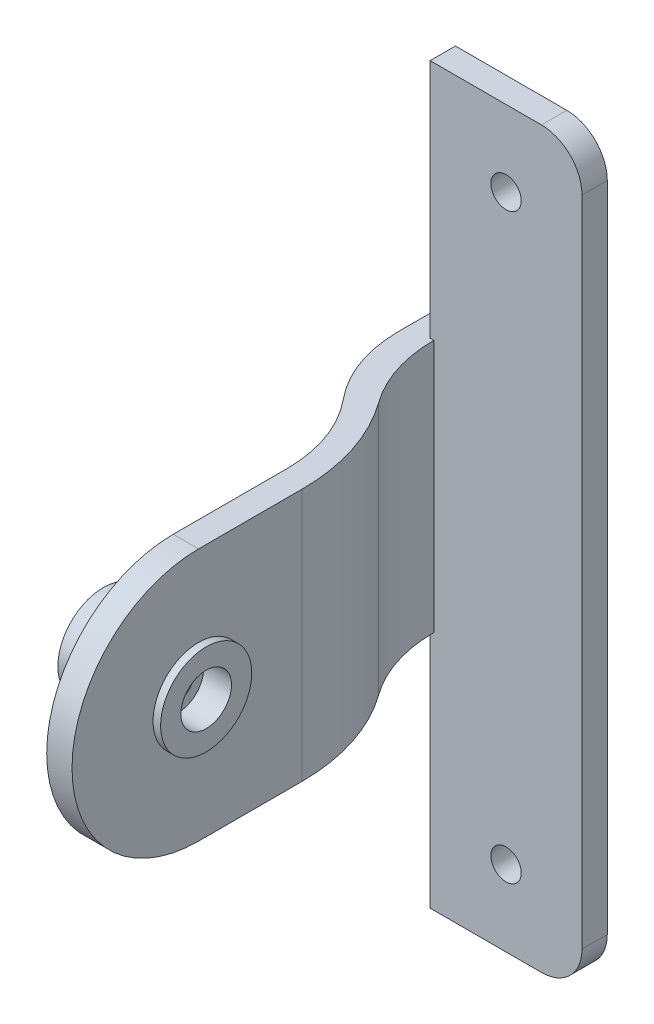
from build123d import *
from build123d.topology import SkipClean

# Parameters (mm, degrees)
SKETCH1_R                = 1.5
BOSS_EXTRUDE1_DEPTH      = 2.5
BOSS_EXTRUDE2_DEPTH      = 6.9
BOSS_EXTRUDE2_DEPTH_BACK = 2.5
SKETCH2_R                = 4.5
SKETCH2_R_2              = 1.5
SKETCH4_R                = 2.5
CUT_EXTRUDE1_DEPTH       = 2
BOSS_EXTRUDE3_START      = 0.75
SKETCH5_R                = 4.5
SKETCH5_R_2              = 2.5
BOSS_EXTRUDE3_DEPTH      = 0.75
BOSS_EXTRUDE4_DEPTH      = 2.5
CUT_EXTRUDE2_REACH       = 80.314
SKETCH7_W                = 7
SKETCH7_H                = 16.5
SKETCH7_W_2              = 16
SKETCH7_H_2              = 8
CUT_EXTRUDE3_REACH       = 82.041
SKETCH9_W                = 2.5
SKETCH9_H                = 22.388822383
BOSS_EXTRUDE5_DEPTH      = 12.5
FILLET2_R                = 1
FILLET3_R                = 4
CUT_EXTRUDE4_DEPTH       = 74.103052287
CUT_EXTRUDE4_DEPTH_BACK  = 74.103052287
SKETCH10_W               = 78.235731334
SKETCH10_H               = 6.290045588
SKETCH11_W               = 14.64
SKETCH11_H               = 2.5
BOSS_EXTRUDE6_DEPTH      = 12.5
BOSS_EXTRUDE7_DEPTH      = 2.5
SKETCH14_R               = 1.5
CUT_EXTRUDE5_DEPTH       = 2.5


with BuildPart() as part:
    # Sketch1 → Boss-Extrude1 (new body)
    with BuildSketch(Plane(origin=(0, 0, 0), x_dir=(0, 0, -1), z_dir=(1, 0, 0))):
        with BuildLine():
            Line((0, 12.5), (34.45, 12.5))
            Line((34.45, 12.5), (34.45, -12.5))
            Line((34.45, -12.5), (0, -12.5))
            ThreePointArc((0, -12.5), (-12.5, 0), (0, 12.5))
        make_face()
        Circle(SKETCH1_R, mode=Mode.SUBTRACT)
    extrude(amount=BOSS_EXTRUDE1_DEPTH)

    # Sketch2 → Boss-Extrude2 (add, two sides: drawn at the far end of the back side and taken through both)
    with BuildSketch(Plane.ZY.offset(-BOSS_EXTRUDE2_DEPTH_BACK)):
        Circle(SKETCH2_R)
        Circle(SKETCH2_R_2, mode=Mode.SUBTRACT)
    extrude(amount=BOSS_EXTRUDE2_DEPTH + BOSS_EXTRUDE2_DEPTH_BACK)

    # Sketch4 → Cut-Extrude1 (cut)
    with BuildSketch(Plane(origin=(2.5, 0, 0), x_dir=(0, 0, -1), z_dir=(1, 0, 0))):
        Circle(SKETCH4_R)
    extrude(amount=-CUT_EXTRUDE1_DEPTH, mode=Mode.SUBTRACT)

    # Sketch5 → Boss-Extrude3 (add)
    with SkipClean():  # the faces are left unmerged after this step: merging them gives an invalid solid
        with BuildSketch(Plane(origin=(2.5, 0, 0), x_dir=(0, 0, -1), z_dir=(1, 0, 0)).offset(BOSS_EXTRUDE3_START)):
            with Locations(Location((0, 0, 0), (0, 0, 180))):
                Circle(SKETCH5_R)
            Circle(SKETCH5_R_2, mode=Mode.SUBTRACT)
        extrude(amount=-BOSS_EXTRUDE3_DEPTH)

    # Sketch6 → Boss-Extrude4 (add)
    with SkipClean():  # the faces are left unmerged after this step: merging them gives an invalid solid
        with BuildSketch(Plane(origin=(0, 0, -34.45), x_dir=(-1, 0, 0), z_dir=(0, 0, -1))):
            Polygon((-8.812505246, 36.25), (53.321583376, 36.25), (53.321583376, -36.25), (6.25, -36.25), (-19.178416624, -36.25), (-19.178416624, 36.25), align=None)
        extrude(amount=-BOSS_EXTRUDE4_DEPTH)
    add(part.part.scale(1), mode=Mode.REPLACE)  # the faces are merged on a copy

    # Sketch7 → Cut-Extrude2 (cut, up to next)
    with BuildSketch(Plane.XY.offset(-31.95), mode=Mode.PRIVATE) as cut_extrude2_sk1:
        with Locations((-1.711858899, -11.632438111)):
            Rectangle(SKETCH7_W, SKETCH7_H)
    cut_extrude2_tool1 = extrude(cut_extrude2_sk1.sketch, amount=-CUT_EXTRUDE2_REACH, mode=Mode.PRIVATE) & part.part
    # Sketch7 → Cut-Extrude2 (cut, up to next)
    with BuildSketch(Plane.XY.offset(-31.95), mode=Mode.PRIVATE) as cut_extrude2_sk2:
        with Locations((-16.5, 0)):
            Rectangle(SKETCH7_W_2, SKETCH7_H_2)
    cut_extrude2_tool2 = extrude(cut_extrude2_sk2.sketch, amount=-CUT_EXTRUDE2_REACH, mode=Mode.PRIVATE) & part.part
    add(cut_extrude2_tool1.solids().sort_by_distance((-1.711859, -11.632438, -31.95))[0], mode=Mode.SUBTRACT)
    add(cut_extrude2_tool2.solids().sort_by_distance((-16.5, 0, -31.95))[0], mode=Mode.SUBTRACT)

    # Sketch9 → Cut-Extrude3 (cut, up to next)
    with BuildSketch(Plane.XZ.offset(12.5), mode=Mode.PRIVATE) as cut_extrude3_sk1:
        with Locations((1.25, -20.755588809)):
            Rectangle(SKETCH9_W, SKETCH9_H)
    cut_extrude3_tool1 = extrude(cut_extrude3_sk1.sketch, amount=-CUT_EXTRUDE3_REACH, mode=Mode.PRIVATE) & part.part
    add(cut_extrude3_tool1.solids().sort_by_distance((1.25, -12.5, -20.755589))[0], mode=Mode.SUBTRACT)


with BuildPart() as cut_extrude3_piece_1:
    # of the separate pieces the step leaves, piece 1, a body of its own (cut_extrude3_pieces)
    add(part.part.solids().sort_by_distance((-53.321583376, 36.25, -31.95))[0])



with BuildPart() as cut_extrude3_piece_2:
    # of the separate pieces the step leaves, piece 2, a body of its own (cut_extrude3_pieces)
    add(part.part.solids().sort_by_distance((0, 12.5, 0))[0])


with BuildPart() as cut_extrude3_piece_1_1:
    add(cut_extrude3_piece_1.part)

    add(cut_extrude3_piece_2.part)  # Boss-Extrude5 merges Cut-Extrude3 piece 2
    # Sketch8 → Boss-Extrude5 (add, symmetric)
    with BuildSketch(Plane(origin=(0, 0, 0), x_dir=(1, 0, 0), z_dir=(0, 1, 0))):
        with BuildLine():
            Line((0, 7.729605828), (2.5, 7.729605828))
            Line((2.5, 7.729605828), (2.5, 10.229605828))
            ThreePointArc((2.5, 10.229605828), (1.573627862, 16.099871922), (-1.115452176, 21.399592472))
            ThreePointArc((-1.115452176, 21.399592472), (-3.053519862, 25.219195088), (-3.721172696, 29.45))
            Line((-3.721172696, 29.45), (-3.721172696, 31.95))
            Line((-3.721172696, 31.95), (-6.221172696, 31.95))
            Line((-6.221172696, 31.95), (-6.221172696, 28.45))
            ThreePointArc((-6.221172696, 28.45), (-5.429444077, 23.92831405), (-3.148463103, 19.944646916))
            ThreePointArc((-3.148463103, 19.944646916), (-0.81124762, 15.862767844), (0, 11.229605828))
            Line((0, 11.229605828), (0, 7.729605828))
        make_face()
    extrude(amount=BOSS_EXTRUDE5_DEPTH, both=True)

    # Fillet2
    fillet2_edges = [cut_extrude3_piece_1_1.edges().sort_by_distance(p)[0] for p in [
        (-8.5, 4, -33.2),
        (-8.5, -4, -33.2),
        (-24.5, -4, -33.2),
        (-24.5, 4, -33.2),
        (-5.211858899, -19.882438111, -33.2),
        (-5.211858899, -3.382438111, -33.2),
        (1.788141101, -3.382438111, -33.2),
        (1.788141101, -19.882438111, -33.2),
    ]]
    fillet(fillet2_edges, radius=FILLET2_R)

    # Fillet3
    fillet3_edges = [cut_extrude3_piece_1_1.edges().sort_by_distance(p)[0] for p in [
        (19.178416624, 36.25, -33.2),
        (-53.321583376, 36.25, -33.2),
        (-53.321583376, -36.25, -33.2),
        (19.178416624, -36.25, -33.2),
    ]]
    fillet(fillet3_edges, radius=FILLET3_R)

    # Sketch10 → Cut-Extrude4 (cut, two sides: drawn at the far end of the back side and taken through both)
    with SkipClean():  # the faces are left unmerged after this step: merging them gives an invalid solid
        with BuildSketch(Plane(origin=(0, 0, 0), x_dir=(1, 0, 0), z_dir=(0, 1, 0)).offset(-CUT_EXTRUDE4_DEPTH_BACK)):
            with Locations((-17.391929865, 35.095022794)):
                Rectangle(SKETCH10_W, SKETCH10_H)
        extrude(amount=CUT_EXTRUDE4_DEPTH + CUT_EXTRUDE4_DEPTH_BACK, mode=Mode.SUBTRACT)

    # Sketch11 → Boss-Extrude6 (add, symmetric)
    with BuildSketch(Plane(origin=(0, 0, 0), x_dir=(1, 0, 0), z_dir=(0, 1, 0))):
        with Locations((3.598827304, 30.7)):
            Rectangle(SKETCH11_W, SKETCH11_H)
    boss_extrude6 = extrude(amount=BOSS_EXTRUDE6_DEPTH, both=True)

    # Sketch13 → Boss-Extrude7 (add)
    with BuildSketch(Plane(origin=(0, 0, -31.95), x_dir=(-1, 0, 0), z_dir=(0, 0, -1))):
        with BuildLine():
            Line((-10.918827304, 12.5), (4.081172696, 12.5))
            Line((4.081172696, 12.5), (4.081172696, 28.75))
            Line((4.081172696, 28.75), (4.081172696, 36.25))
            Line((4.081172696, 36.25), (-3.678827304, 36.25))
            Line((-3.678827304, 36.25), (-6.918827304, 36.25))
            ThreePointArc((-6.918827304, 36.25), (-9.747254429, 35.078427125), (-10.918827304, 32.25))
            Line((-10.918827304, 32.25), (-10.918827304, 28.75))
            Line((-10.918827304, 28.75), (-10.918827304, 12.5))
        make_face()
    boss_extrude7 = extrude(amount=-BOSS_EXTRUDE7_DEPTH)

    # Mirror1: Boss-Extrude6, Boss-Extrude7 across plane
    add(boss_extrude6.mirror(Plane.ZX))
    add(boss_extrude7.mirror(Plane.ZX))

    # Sketch14 → Cut-Extrude5 (cut)
    with BuildSketch(Plane(origin=(0, 0, -31.95), x_dir=(-1, 0, 0), z_dir=(0, 0, -1))):
        with Locations((-3.418827304, 28.75)):
            Circle(SKETCH14_R)
    cut_extrude5 = extrude(amount=-CUT_EXTRUDE5_DEPTH, mode=Mode.SUBTRACT)

    # Mirror2: Cut-Extrude5 across plane
    add(cut_extrude5.mirror(Plane.ZX), mode=Mode.SUBTRACT)


solid = cut_extrude3_piece_1_1.part
